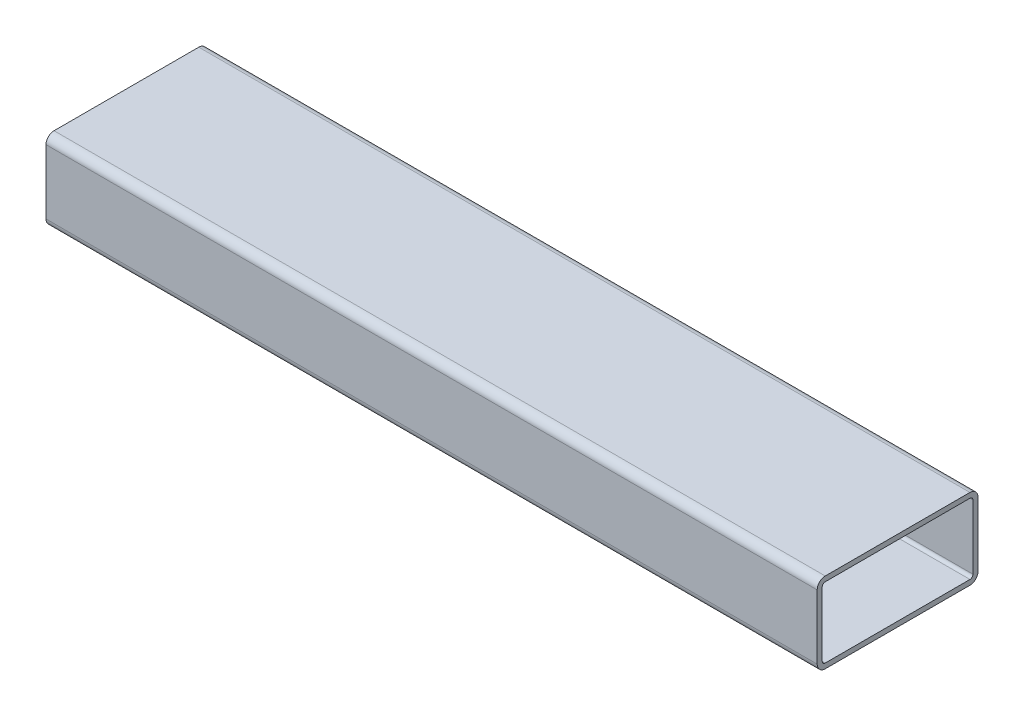
from build123d import *

# Parameters (mm, degrees)
EXTRUDE_THIN1_DEPTH = 243.6368


with BuildPart() as part:
    # Sketch1 → Extrude-Thin1 (new body)
    with BuildSketch(Plane(origin=(0, 0, 0), x_dir=(0, 0, -1), z_dir=(1, 0, 0))):
        with BuildLine():
            Line((-48.26, 25.4), (-2.54, 25.4))
            ThreePointArc((-2.54, 25.4), (-0.743948776, 24.656051224), (0, 22.86))
            Line((0, 22.86), (0, 2.54))
            ThreePointArc((0, 2.54), (-0.743948776, 0.743948776), (-2.54, 0))
            Line((-2.54, 0), (-48.26, 0))
            ThreePointArc((-48.26, 0), (-50.056051224, 0.743948776), (-50.8, 2.54))
            Line((-50.8, 2.54), (-50.8, 22.86))
            ThreePointArc((-50.8, 22.86), (-50.056051224, 24.656051224), (-48.26, 25.4))
        make_face()
        with BuildLine():
            Line((-48.26, 23.8125), (-2.54, 23.8125))
            ThreePointArc((-2.54, 23.8125), (-1.866480791, 23.533519209), (-1.5875, 22.86))
            Line((-1.5875, 22.86), (-1.5875, 2.54))
            ThreePointArc((-1.5875, 2.54), (-1.866480791, 1.866480791), (-2.54, 1.5875))
            Line((-2.54, 1.5875), (-48.26, 1.5875))
            ThreePointArc((-48.26, 1.5875), (-48.933519209, 1.866480791), (-49.2125, 2.54))
            Line((-49.2125, 2.54), (-49.2125, 22.86))
            ThreePointArc((-49.2125, 22.86), (-48.933519209, 23.533519209), (-48.26, 23.8125))
        make_face(mode=Mode.SUBTRACT)
    extrude(amount=-EXTRUDE_THIN1_DEPTH)


solid = part.part
